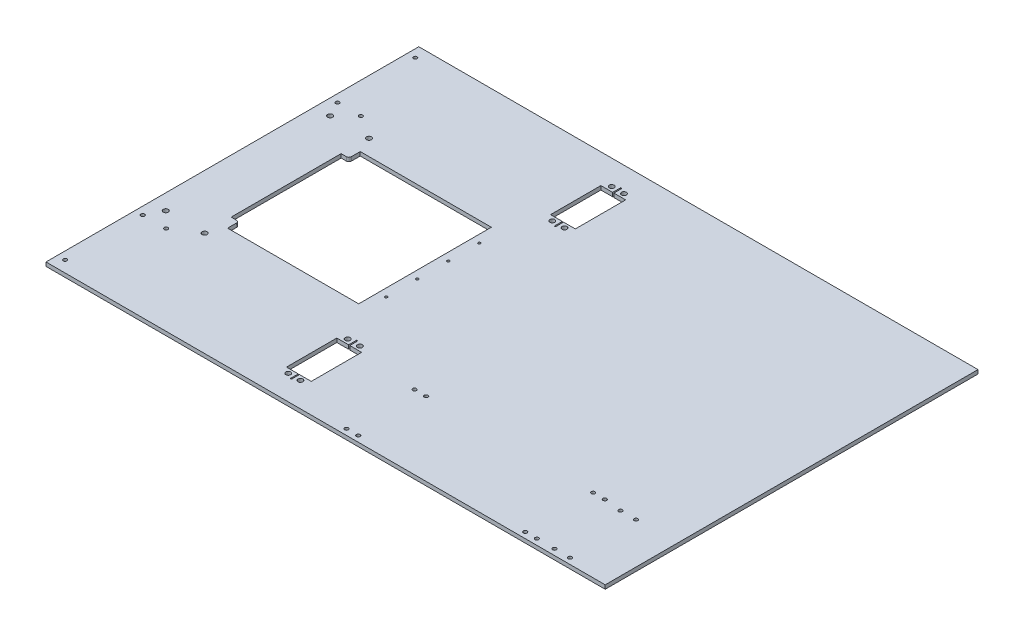
from build123d import *

# Parameters (mm, degrees)
SKETCH1_W           = 457.2
SKETCH1_H           = 304.8
BOSS_EXTRUDE1_DEPTH = 3.175
SKETCH2_R           = 2.063499937
SKETCH2_R_2         = 2.063500064
CUT_EXTRUDE1_DEPTH  = 275.761352131
CUT_EXTRUDE2_REACH  = 276.761
SKETCH5_R           = 1.500000048
CUT_EXTRUDE3_DEPTH  = 275.761352131
SKETCH7_R           = 2.000000064
CUT_EXTRUDE5_DEPTH  = 275.761352131
SKETCH8_R           = 1.000000032
CUT_EXTRUDE6_DEPTH  = 275.761352131
SKETCH12_R          = 1.500000048
CUT_EXTRUDE7_DEPTH  = 275.761352131


with BuildPart() as part:
    # Sketch1 → Boss-Extrude1 (new body)
    with BuildSketch(Plane(origin=(0, 0, 0), x_dir=(1, 0, 0), z_dir=(0, 1, 0))):
        Rectangle(SKETCH1_W, SKETCH1_H)
    extrude(amount=BOSS_EXTRUDE1_DEPTH)

    # Sketch2 → Cut-Extrude1 (cut, through all)
    with BuildSketch(Plane(origin=(0, 3.175, 0), x_dir=(1, 0, 0), z_dir=(0, 1, 0))):
        with Locations((-184.15, -67.197573915)):
            Circle(SKETCH2_R)
        with Locations((-215.9, -67.197573915)):
            Circle(SKETCH2_R_2)
        with Locations((-184.15, 67.197573915)):
            Circle(SKETCH2_R)
        with Locations((-215.9, 67.197573915)):
            Circle(SKETCH2_R_2)
    extrude(amount=-CUT_EXTRUDE1_DEPTH, mode=Mode.SUBTRACT)

    # Sketch4 → Cut-Extrude2 (cut, up to next)
    with BuildSketch(Plane(origin=(0, 3.175, 0), x_dir=(1, 0, 0), z_dir=(0, 1, 0)), mode=Mode.PRIVATE) as cut_extrude2_sk1:
        with BuildLine():
            Line((-184.658, 44.958), (-184.658, -44.958))
            Line((-184.658, -44.958), (-180.34, -44.958))
            ThreePointArc((-180.34, -44.958), (-178.903159021, -45.553159021), (-178.308, -46.99))
            Line((-178.308, -46.99), (-178.308, -54.229))
            Line((-178.308, -54.229), (-71.12, -54.229))
            Line((-71.12, -54.229), (-71.12, 54.229))
            Line((-71.12, 54.229), (-178.308, 54.229))
            Line((-178.308, 54.229), (-178.308, 46.99))
            ThreePointArc((-178.308, 46.99), (-178.903159021, 45.553159021), (-180.34, 44.958))
            Line((-180.34, 44.958), (-184.658, 44.958))
        make_face()
    cut_extrude2_tool1 = extrude(cut_extrude2_sk1.sketch, amount=-CUT_EXTRUDE2_REACH, mode=Mode.PRIVATE) & part.part
    add(cut_extrude2_tool1.solids().sort_by_distance((-127.379078, 3.175, 0))[0], mode=Mode.SUBTRACT)

    # Sketch5 → Cut-Extrude3 (cut, through all)
    with BuildSketch(Plane(origin=(0, 3.175, 0), x_dir=(1, 0, 0), z_dir=(0, 1, 0))):
        with Locations((-203.2, 79.629)):
            Circle(SKETCH5_R)
        with Locations((-222.25, 143.129)):
            Circle(SKETCH5_R)
        with Locations((-222.25, 79.629)):
            Circle(SKETCH5_R)
        with Locations((-203.2, -79.629)):
            Circle(SKETCH5_R)
        with Locations((-222.25, -79.629)):
            Circle(SKETCH5_R)
        with Locations((-222.25, -143.129)):
            Circle(SKETCH5_R)
    extrude(amount=-CUT_EXTRUDE3_DEPTH, mode=Mode.SUBTRACT)

    # Sketch7 → Cut-Extrude5 (cut, through all)
    with BuildSketch(Plane(origin=(0, 3.175, 0), x_dir=(1, 0, 0), z_dir=(0, 1, 0))):
        with Locations((-50.720000033, -132.250000041)):
            Circle(SKETCH7_R)
        with Locations((-40.719999967, -132.250000041)):
            Circle(SKETCH7_R)
        with Locations((-50.720000033, -83.649999959)):
            Circle(SKETCH7_R)
        with Locations((-40.719999967, -83.649999959)):
            Circle(SKETCH7_R)
        Polygon((-55.846999939, -87.373000006), (-46.22, -87.373000006), (-46.22, -80.769000006), (-45.22, -80.769000006), (-45.22, -87.373000006), (-35.593000061, -87.373000006), (-35.593000061, -128.526999994), (-45.22, -128.526999994), (-45.22, -135.130999994), (-46.22, -135.130999994), (-46.22, -128.526999994), (-55.846999939, -128.526999994), align=None)
    cut_extrude5 = extrude(amount=-CUT_EXTRUDE5_DEPTH, mode=Mode.SUBTRACT)

    # Mirror1: Cut-Extrude5 across plane
    add(cut_extrude5.mirror(Plane.XY), mode=Mode.SUBTRACT)

    # Sketch8 → Cut-Extrude6 (cut, through all)
    with BuildSketch(Plane(origin=(0, 3.175, 0), x_dir=(1, 0, 0), z_dir=(0, 1, 0))):
        with Locations((-64.77, -38.1)):
            Circle(SKETCH8_R)
        with Locations((-64.77, -12.7)):
            Circle(SKETCH8_R)
        with Locations((-64.77, 12.7)):
            Circle(SKETCH8_R)
        with Locations((-64.77, 38.1)):
            Circle(SKETCH8_R)
    extrude(amount=-CUT_EXTRUDE6_DEPTH, mode=Mode.SUBTRACT)

    # Sketch12 → Cut-Extrude7 (cut, through all)
    with BuildSketch(Plane(origin=(0, 3.175, 0), x_dir=(1, 0, 0), z_dir=(0, 1, 0))):
        with Locations((195.02400008, -93.662499871)):
            Circle(SKETCH12_R)
        with Locations((182.32400008, -93.662499871)):
            Circle(SKETCH12_R)
        with Locations((195.02400008, -147.637499871)):
            Circle(SKETCH12_R)
        with Locations((182.32400008, -147.637499871)):
            Circle(SKETCH12_R)
        with Locations((167.957499784, -92.07499992)):
            Circle(SKETCH12_R)
        with Locations((158.432499784, -92.07499992)):
            Circle(SKETCH12_R)
        with Locations((167.957499784, -147.63749992)):
            Circle(SKETCH12_R)
        with Locations((158.432499784, -147.63749992)):
            Circle(SKETCH12_R)
        with Locations((21.907499785, -147.637499852)):
            Circle(SKETCH12_R)
        with Locations((12.382499785, -147.637499852)):
            Circle(SKETCH12_R)
        with Locations((12.382499785, -92.074999852)):
            Circle(SKETCH12_R)
        with Locations((21.907499785, -92.074999852)):
            Circle(SKETCH12_R)
    extrude(amount=-CUT_EXTRUDE7_DEPTH, mode=Mode.SUBTRACT)


solid = part.part
